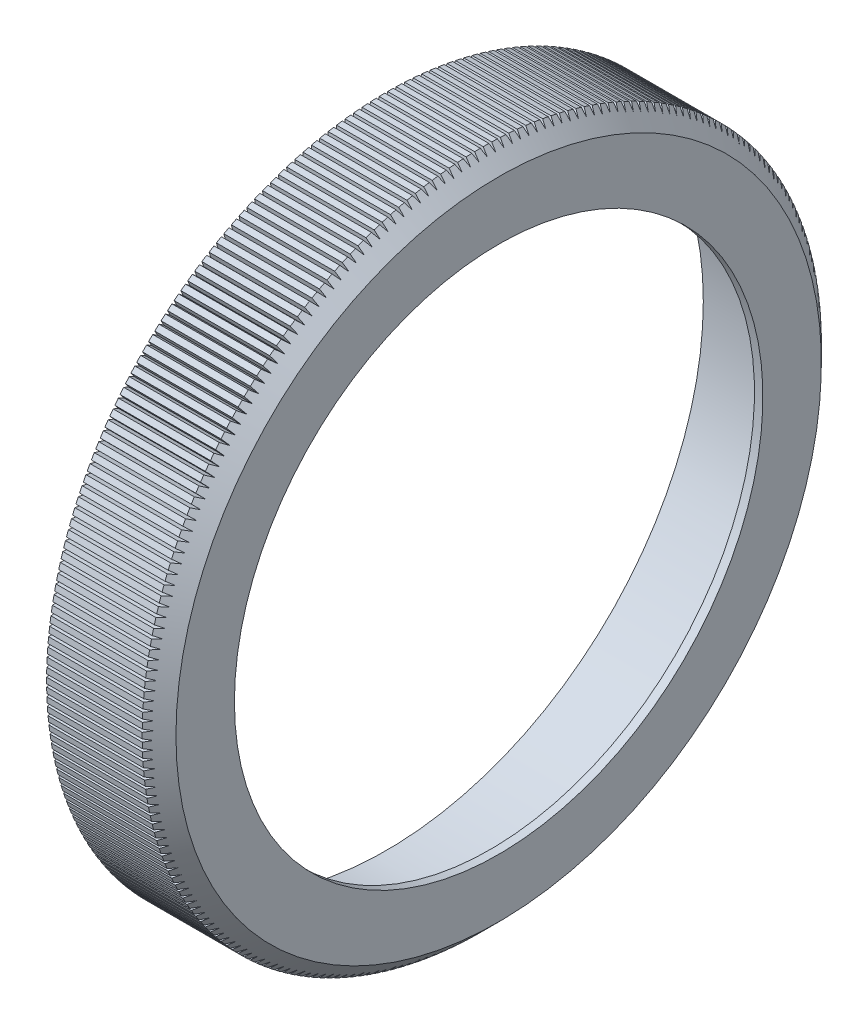
from build123d import *

# Parameters (mm, degrees)
CHANFREIN1_SIZE              = 3
ENL_V_MAT_EXTRU_1_DEPTH      = 88.728672622
R_P_TITION_CIRCULAIRE1_COUNT = 250


with BuildPart() as part:
    # Esquisse1 → Révolution1 (revolve)
    with BuildSketch(Plane.XY):
        Polygon((15.5, 56.4), (34, 56.4), (34, 47), (35.5, 47), (35.5, 60.4), (15.5, 60.4), align=None)
    revolve(axis=Axis((0, 0, 0), (1, 0, 0)))

    # Chanfrein1
    chanfrein1_edges = [part.edges().sort_by_distance(p)[0] for p in [
        (35.5, -60.4, 0),
    ]]
    chamfer(chanfrein1_edges, length=CHANFREIN1_SIZE)

    # Esquisse2 → Enlèv. mat.-Extru.1 (cut, through all)
    with BuildSketch(Plane(origin=(35.5, 0, 0), x_dir=(0, 0, -1), z_dir=(1, 0, 0))):
        Polygon((-0.25, 60.4), (0, 59.4), (0.25, 60.4), align=None)
    enl_v_mat_extru_1 = extrude(amount=-ENL_V_MAT_EXTRU_1_DEPTH, mode=Mode.SUBTRACT)

    # Répétition circulaire1: Enlèv. mat.-Extru.1 ×250 about axis
    r_p_tition_circulaire1_axis = Axis((35.5, 0, 0), (-1, 0, 0))
    for i in range(1, R_P_TITION_CIRCULAIRE1_COUNT):
        add(enl_v_mat_extru_1.rotate(r_p_tition_circulaire1_axis, i * 360 / R_P_TITION_CIRCULAIRE1_COUNT), mode=Mode.SUBTRACT)


solid = part.part
